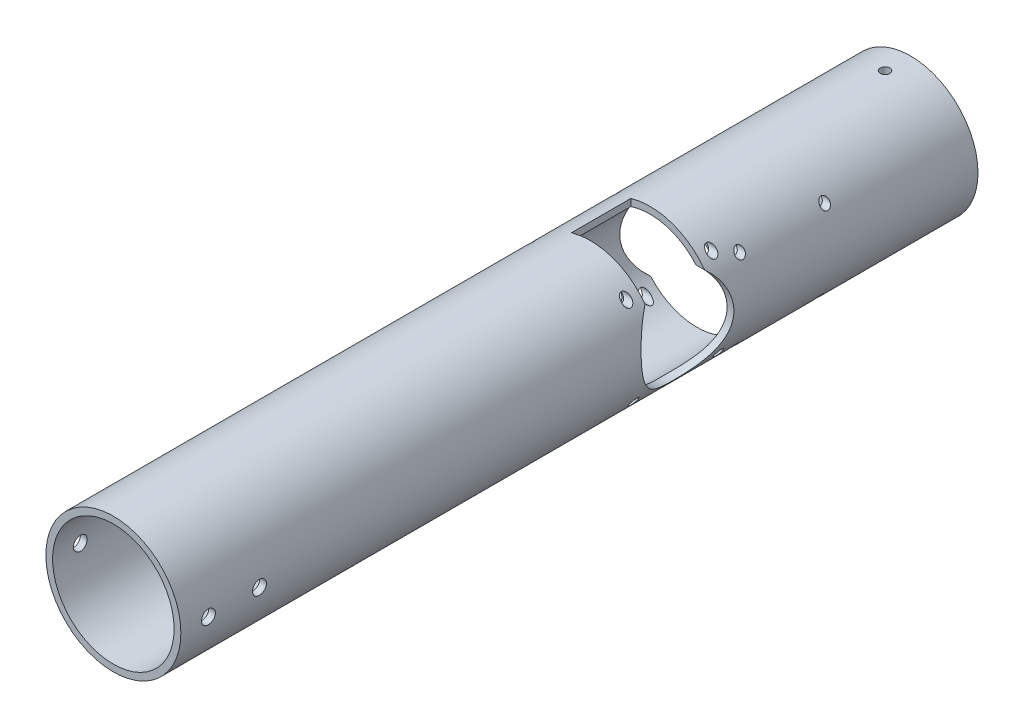
from build123d import *

# Parameters (mm, degrees)
BOSS_EXTRUDE1_DEPTH           = 125
BOSS_EXTRUDE1_DEPTH_BACK      = 250
SKETCH1_R                     = 31.75
SKETCH1_R_2                   = 28.575
SKETCH2_R                     = 21.75
CUT_EXTRUDE1_DEPTH            = 255.000246063
SKETCH3_R                     = 21.75
CUT_EXTRUDE2_DEPTH            = 255.000246186
CUT_EXTRUDE4_START            = 9
SKETCH5_W                     = 28
SKETCH5_H                     = 22
CUT_EXTRUDE4_DEPTH            = 264.000246186
CUT_EXTRUDE5_START            = -9
SKETCH6_W                     = 28
SKETCH6_H                     = 22
CUT_EXTRUDE5_DEPTH            = 264.000246186
CUT_EXTRUDE8_DEPTH            = 255.000246186
CUT_EXTRUDE8_DEPTH_BACK       = 255.000246186
SKETCH11_R                    = 2
CUT_EXTRUDE10_DEPTH           = 255.000246186
CUT_EXTRUDE10_DEPTH_BACK      = 255.000246186
SKETCH12_R                    = 3.25
CUT_EXTRUDE11_DEPTH           = 255.000246186
CUT_EXTRUDE11_DEPTH_BACK      = 255.000246186
SKETCH13_R                    = 2.25
CUT_EXTRUDE12_DEPTH           = 255.000246189
CUT_EXTRUDE12_DEPTH_BACK      = 255.000246189
SKETCH15_R                    = 2
SKETCH19_W                    = 2.25
SKETCH19_H                    = 31.75
M4_CLEARANCE_HOLE1_AT_2_COUNT = 2
M4_CLEARANCE_HOLE1_AT_2_PITCH = 40
M4_CLEARANCE_HOLE1_AT_3_COUNT = 2
M4_CLEARANCE_HOLE1_AT_3_PITCH = 40
M4_CLEARANCE_HOLE1_AT_4_COUNT = 2
M4_CLEARANCE_HOLE1_AT_4_PITCH = 56.568542495
M4_CLEARANCE_HOLE1_AT_5_COUNT = 2
M4_CLEARANCE_HOLE1_AT_5_PITCH = 90.126807577
M4_CLEARANCE_HOLE1_AT_6_COUNT = 2
M4_CLEARANCE_HOLE1_AT_6_PITCH = 50.197623888
M4_CLEARANCE_HOLE1_AT_7_COUNT = 2
M4_CLEARANCE_HOLE1_AT_7_PITCH = 100.213978286
M4_CLEARANCE_HOLE1_AT_8_COUNT = 2
M4_CLEARANCE_HOLE1_AT_8_PITCH = 66.631835064
MIRROR1_COPY_1_SKETCH_W       = 2.25
MIRROR1_COPY_1_SKETCH_H       = 31.75
MIRROR1_COPY_2_SKETCH_W       = 2.25
MIRROR1_COPY_2_SKETCH_H       = 31.75
MIRROR1_COPY_3_SKETCH_W       = 2.25
MIRROR1_COPY_3_SKETCH_H       = 31.75
MIRROR1_COPY_4_SKETCH_W       = 2.25
MIRROR1_COPY_4_SKETCH_H       = 31.75
MIRROR1_COPY_5_SKETCH_W       = 2.25
MIRROR1_COPY_5_SKETCH_H       = 31.75
MIRROR1_COPY_6_SKETCH_W       = 2.25
MIRROR1_COPY_6_SKETCH_H       = 31.75
MIRROR1_COPY_7_SKETCH_W       = 2.25
MIRROR1_COPY_7_SKETCH_H       = 31.75
SKETCH21_R                    = 30
CUT_EXTRUDE14_DEPTH           = 7


with BuildPart() as part:
    # Sketch1 → Boss-Extrude1 (new, two sides: drawn at the far end of the back side and taken through both)
    with BuildSketch(Plane.XY.offset(-BOSS_EXTRUDE1_DEPTH_BACK)):
        Circle(SKETCH1_R)
        Circle(SKETCH1_R_2, mode=Mode.SUBTRACT)
    extrude(amount=BOSS_EXTRUDE1_DEPTH + BOSS_EXTRUDE1_DEPTH_BACK)

    # Sketch2 → Cut-Extrude1 (cut, through all)
    with BuildSketch(Plane(origin=(0, 0, 0), x_dir=(0, 0, -1), z_dir=(1, 0, 0))):
        with Locations((163.488, -2)):
            Circle(SKETCH2_R)
    extrude(amount=-CUT_EXTRUDE1_DEPTH, mode=Mode.SUBTRACT)

    # Sketch3 → Cut-Extrude2 (cut, through all)
    with BuildSketch(Plane(origin=(0, 0, 0), x_dir=(0, 0, -1), z_dir=(1, 0, 0))):
        with Locations((113.45, 2)):
            Circle(SKETCH3_R)
    extrude(amount=CUT_EXTRUDE2_DEPTH, mode=Mode.SUBTRACT)

    # Sketch5 → Cut-Extrude4 (cut, through all)
    with BuildSketch(Plane(origin=(0, 0, 0), x_dir=(0, 0, -1), z_dir=(1, 0, 0)).offset(CUT_EXTRUDE4_START)):
        with Locations((163.488, -23.75)):
            Rectangle(SKETCH5_W, SKETCH5_H)
    extrude(amount=-CUT_EXTRUDE4_DEPTH, mode=Mode.SUBTRACT)

    # Sketch6 → Cut-Extrude5 (cut, through all)
    with BuildSketch(Plane(origin=(0, 0, 0), x_dir=(0, 0, -1), z_dir=(1, 0, 0)).offset(CUT_EXTRUDE5_START)):
        with Locations((113.45, 23.75)):
            Rectangle(SKETCH6_W, SKETCH6_H)
    extrude(amount=CUT_EXTRUDE5_DEPTH, mode=Mode.SUBTRACT)

    # Sketch11 → Cut-Extrude8 (cut, two sides: drawn at the far end of the back side and taken through both)
    with BuildSketch(Plane(origin=(0, 0, 0), x_dir=(0, 0, -1), z_dir=(1, 0, 0)).offset(-CUT_EXTRUDE8_DEPTH_BACK)):
        with Locations((183.488, 18)):
            Circle(SKETCH11_R)
        with Locations((143.488, 18)):
            Circle(SKETCH11_R)
        with Locations((143.488, -22)):
            Circle(SKETCH11_R)
        with Locations((183.488, -22)):
            Circle(SKETCH11_R)
    extrude(amount=CUT_EXTRUDE8_DEPTH + CUT_EXTRUDE8_DEPTH_BACK, mode=Mode.SUBTRACT)

    # Sketch12 → Cut-Extrude10 (cut, two sides: drawn at the far end of the back side and taken through both)
    with BuildSketch(Plane(origin=(0, 0, 0), x_dir=(0, 0, -1), z_dir=(1, 0, 0)).offset(-CUT_EXTRUDE10_DEPTH_BACK)):
        with Locations((-112, 0)):
            Circle(SKETCH12_R)
        with Locations((-88, 0)):
            Circle(SKETCH12_R)
    extrude(amount=CUT_EXTRUDE10_DEPTH + CUT_EXTRUDE10_DEPTH_BACK, mode=Mode.SUBTRACT)

    # Sketch13 → Cut-Extrude11 (cut, two sides: drawn at the far end of the back side and taken through both)
    with BuildSketch(Plane(origin=(0, 0, 0), x_dir=(1, 0, 0), z_dir=(0, 1, 0)).offset(-CUT_EXTRUDE11_DEPTH_BACK)):
        with Locations((0, 238)):
            Circle(SKETCH13_R)
    extrude(amount=CUT_EXTRUDE11_DEPTH + CUT_EXTRUDE11_DEPTH_BACK, mode=Mode.SUBTRACT)

    # Sketch15 → Cut-Extrude12 (cut, two sides: drawn at the far end of the back side and taken through both)
    with BuildSketch(Plane(origin=(0, 0, 0), x_dir=(0, 0, -1), z_dir=(1, 0, 0)).offset(-CUT_EXTRUDE12_DEPTH_BACK)):
        with Locations((93.45, 22)):
            Circle(SKETCH15_R)
        with Locations((133.45, 22)):
            Circle(SKETCH15_R)
        with Locations((133.45, -18)):
            Circle(SKETCH15_R)
        with Locations((93.45, -18)):
            Circle(SKETCH15_R)
    extrude(amount=CUT_EXTRUDE12_DEPTH + CUT_EXTRUDE12_DEPTH_BACK, mode=Mode.SUBTRACT)

    # Sketch19 → M4 Clearance Hole1 (revolve, cut)
    with BuildSketch(Plane(origin=(0, 22, -93.45), x_dir=(0, 0, 1), z_dir=(0, 1, 0))):
        with Locations((1.125, 15.875)):
            Rectangle(SKETCH19_W, SKETCH19_H)
    m4_clearance_hole1 = revolve(axis=Axis((-6.35, 22, -93.45), (1, 0, 0)), mode=Mode.SUBTRACT)

    # M4 Clearance Hole1 at 2: M4 Clearance Hole1 ×2
    with Locations(*[(0, 0, -i * M4_CLEARANCE_HOLE1_AT_2_PITCH) for i in range(1, M4_CLEARANCE_HOLE1_AT_2_COUNT)]):
        add(m4_clearance_hole1, mode=Mode.SUBTRACT)

    # M4 Clearance Hole1 at 3: M4 Clearance Hole1 ×2
    with Locations(*[(0, -i * M4_CLEARANCE_HOLE1_AT_3_PITCH, 0) for i in range(1, M4_CLEARANCE_HOLE1_AT_3_COUNT)]):
        add(m4_clearance_hole1, mode=Mode.SUBTRACT)

    # M4 Clearance Hole1 at 4: M4 Clearance Hole1 ×2
    with Locations(*[Vector(0, -0.7071067811865475, -0.7071067811865477) * (i * M4_CLEARANCE_HOLE1_AT_4_PITCH) for i in range(1, M4_CLEARANCE_HOLE1_AT_4_COUNT)]):
        add(m4_clearance_hole1, mode=Mode.SUBTRACT)

    # M4 Clearance Hole1 at 5: M4 Clearance Hole1 ×2
    with Locations(*[Vector(0, -0.04438191152602299, -0.9990146374950151) * (i * M4_CLEARANCE_HOLE1_AT_5_PITCH) for i in range(1, M4_CLEARANCE_HOLE1_AT_5_COUNT)]):
        add(m4_clearance_hole1, mode=Mode.SUBTRACT)

    # M4 Clearance Hole1 at 6: M4 Clearance Hole1 ×2
    with Locations(*[Vector(0, -0.07968504662542596, -0.9968200907607669) * (i * M4_CLEARANCE_HOLE1_AT_6_PITCH) for i in range(1, M4_CLEARANCE_HOLE1_AT_6_COUNT)]):
        add(m4_clearance_hole1, mode=Mode.SUBTRACT)

    # M4 Clearance Hole1 at 7: M4 Clearance Hole1 ×2
    with Locations(*[Vector(0, -0.43906050585303286, -0.8984574960453493) * (i * M4_CLEARANCE_HOLE1_AT_7_PITCH) for i in range(1, M4_CLEARANCE_HOLE1_AT_7_COUNT)]):
        add(m4_clearance_hole1, mode=Mode.SUBTRACT)

    # M4 Clearance Hole1 at 8: M4 Clearance Hole1 ×2
    with Locations(*[Vector(0, -0.6603450131265123, -0.7509623583369186) * (i * M4_CLEARANCE_HOLE1_AT_8_PITCH) for i in range(1, M4_CLEARANCE_HOLE1_AT_8_COUNT)]):
        add(m4_clearance_hole1, mode=Mode.SUBTRACT)

    # Mirror1: M4 Clearance Hole1 across plane
    add(m4_clearance_hole1.mirror(Plane(origin=(0, 0, 0), x_dir=(0, 0, 1), z_dir=(1, 0, 0))), mode=Mode.SUBTRACT)

    # Mirror1 copy 1 sketch → Mirror1 copy 1 (revolve, cut)
    with BuildSketch(Plane(origin=(0, 22, -133.45), x_dir=(0, 0, 1), z_dir=(0, 1, 0))):
        with Locations((1.125, -15.875)):
            Rectangle(MIRROR1_COPY_1_SKETCH_W, MIRROR1_COPY_1_SKETCH_H)
    revolve(axis=Axis((6.35, 22, -133.45), (1, 0, 0)), mode=Mode.SUBTRACT)

    # Mirror1 copy 2 sketch → Mirror1 copy 2 (revolve, cut)
    with BuildSketch(Plane(origin=(0, -18, -93.45), x_dir=(0, 0, 1), z_dir=(0, 1, 0))):
        with Locations((1.125, -15.875)):
            Rectangle(MIRROR1_COPY_2_SKETCH_W, MIRROR1_COPY_2_SKETCH_H)
    revolve(axis=Axis((6.35, -18, -93.45), (1, 0, 0)), mode=Mode.SUBTRACT)

    # Mirror1 copy 3 sketch → Mirror1 copy 3 (revolve, cut)
    with BuildSketch(Plane(origin=(0, -18, -133.45), x_dir=(0, 0, 1), z_dir=(0, 1, 0))):
        with Locations((1.125, -15.875)):
            Rectangle(MIRROR1_COPY_3_SKETCH_W, MIRROR1_COPY_3_SKETCH_H)
    revolve(axis=Axis((6.35, -18, -133.45), (1, 0, 0)), mode=Mode.SUBTRACT)

    # Mirror1 copy 4 sketch → Mirror1 copy 4 (revolve, cut)
    with BuildSketch(Plane(origin=(0, 18, -183.488), x_dir=(0, 0, 1), z_dir=(0, 1, 0))):
        with Locations((1.125, -15.875)):
            Rectangle(MIRROR1_COPY_4_SKETCH_W, MIRROR1_COPY_4_SKETCH_H)
    revolve(axis=Axis((6.35, 18, -183.488), (1, 0, 0)), mode=Mode.SUBTRACT)

    # Mirror1 copy 5 sketch → Mirror1 copy 5 (revolve, cut)
    with BuildSketch(Plane(origin=(0, 18, -143.488), x_dir=(0, 0, 1), z_dir=(0, 1, 0))):
        with Locations((1.125, -15.875)):
            Rectangle(MIRROR1_COPY_5_SKETCH_W, MIRROR1_COPY_5_SKETCH_H)
    revolve(axis=Axis((6.35, 18, -143.488), (1, 0, 0)), mode=Mode.SUBTRACT)

    # Mirror1 copy 6 sketch → Mirror1 copy 6 (revolve, cut)
    with BuildSketch(Plane(origin=(0, -22, -183.488), x_dir=(0, 0, 1), z_dir=(0, 1, 0))):
        with Locations((1.125, -15.875)):
            Rectangle(MIRROR1_COPY_6_SKETCH_W, MIRROR1_COPY_6_SKETCH_H)
    revolve(axis=Axis((6.35, -22, -183.488), (1, 0, 0)), mode=Mode.SUBTRACT)

    # Mirror1 copy 7 sketch → Mirror1 copy 7 (revolve, cut)
    with BuildSketch(Plane(origin=(0, -22, -143.488), x_dir=(0, 0, 1), z_dir=(0, 1, 0))):
        with Locations((1.125, -15.875)):
            Rectangle(MIRROR1_COPY_7_SKETCH_W, MIRROR1_COPY_7_SKETCH_H)
    revolve(axis=Axis((6.35, -22, -143.488), (1, 0, 0)), mode=Mode.SUBTRACT)

    # Sketch21 → Cut-Extrude14 (cut)
    with BuildSketch(Plane(origin=(0, 0, -250), x_dir=(-1, 0, 0), z_dir=(0, 0, -1))):
        Circle(SKETCH21_R)
    extrude(amount=-CUT_EXTRUDE14_DEPTH, mode=Mode.SUBTRACT)


solid = part.part
